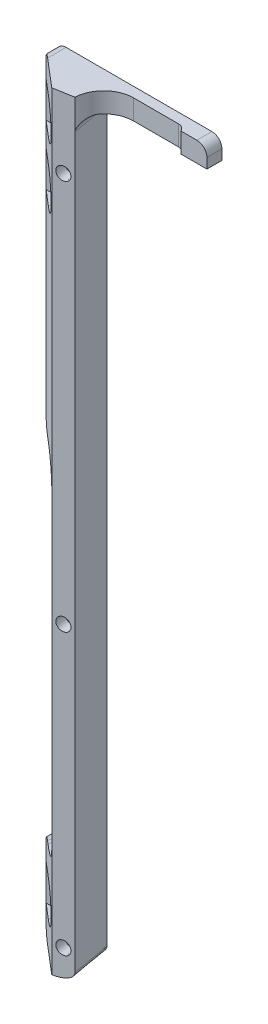
from build123d import *

# Parameters (mm, degrees)
SKETCH2_W                  = 82.738044028
SKETCH2_H                  = 243.598411898
BOSS_EXTRUDE1_DEPTH        = 3.175
BOSS_EXTRUDE2_DEPTH        = 243.598412
CUT_EXTRUDE1_DEPTH         = 6253.234293578
CUT_EXTRUDE1_DEPTH_BACK    = 6253.234293578
SKETCH3_W                  = 10.058364279
SKETCH3_H                  = 111.125
FILLET1_R                  = 6.35
CUT_EXTRUDE2_DEPTH         = 6243.564603497
DELETEFACE2_START          = 830.447299741
DELETEFACE2_OUTLINE_W      = 243.598411898
DELETEFACE2_OUTLINE_H      = 6
DELETEFACE2_DEPTH          = 0.551332964
F_6_0_204_DIAMETER_HOLE1_D = 5.1816
CUT_EXTRUDE3_START         = 3.175
CUT_EXTRUDE3_DEPTH         = 6231.095925463
SKETCH10_W                 = 38.1
SKETCH10_H                 = 3.175
BOSS_EXTRUDE4_DEPTH        = 6.35
BOSS_EXTRUDE6_DEPTH        = 1.5875
CUT_EXTRUDE4_DEPTH         = 913.829845298
FILLET2_R                  = 9.525
FILLET3_R                  = 3.175
SKETCH13_W                 = 8.255
SKETCH13_H                 = 6.35
BOSS_EXTRUDE5_DEPTH        = 1.5875
FILLET4_R                  = 2.54
FILLET5_SIZE               = 6.35
FILLET5_SIZE_2             = 3.175
FILLET6_R                  = 3.175
HOLE1_AT_2_COUNT           = 2
HOLE1_AT_2_PITCH           = 123.825
HOLE1_AT_3_COUNT           = 2
HOLE1_AT_3_PITCH           = 212.6865263
F_4_CLEARANCE_HOLE1_D      = 3.4544


# Read off the part's stored shape, not the designer's step: DeleteFace2
with BuildPart() as part:
    # Sketch2 → Boss-Extrude1 (new body)
    with BuildSketch(Plane.XY):
        with Locations((870.137648104, 6053.851709568)):
            Rectangle(SKETCH2_W, SKETCH2_H)
    extrude(amount=BOSS_EXTRUDE1_DEPTH)

    # Sketch5 → Boss-Extrude2 (add, through all)
    with BuildSketch(Plane(origin=(0, 6175.650915517, 0), x_dir=(1, 0, 0), z_dir=(0, 1, 0))):
        Polygon((828.76862609, -3.175), (840.781978058, -13.382293294), (845.472124982, -12.555293847), (843.81812609, -3.175), align=None)
    extrude(amount=-BOSS_EXTRUDE2_DEPTH)

    # Sketch3 → Cut-Extrude1 (cut, two sides: drawn at the far end of the back side and taken through both)
    with BuildSketch(Plane(origin=(1789.89403363, 0, -153.971769821), x_dir=(-0.9848077530122082, 0, 0.17364817766692958), z_dir=(-0.17364817766692958, 0, -0.9848077530122082)).offset(-CUT_EXTRUDE1_DEPTH_BACK)):
        with Locations((968.782821029, 6016.190003619)):
            Rectangle(SKETCH3_W, SKETCH3_H)
    extrude(amount=CUT_EXTRUDE1_DEPTH + CUT_EXTRUDE1_DEPTH_BACK, mode=Mode.SUBTRACT)

    # Fillet1
    fillet1_edges = [part.edges().sort_by_distance(p)[0] for p in [
        (839.602148372, 6071.752503619, 6.691146647),
        (839.602148372, 5960.627503619, 6.691146647),
    ]]
    fillet(fillet1_edges, radius=FILLET1_R)

    # Sketch4 → Cut-Extrude2 (cut, through all)
    with BuildSketch(Plane.XY.offset(3.175)):
        Polygon((843.81812609, 6170.570915517), (843.81812609, 6175.650915517), (911.506670118, 6175.650915517), (911.506670118, 5932.052503619), (905.156670118, 5932.052503619), (843.81812609, 5932.052503619), align=None)
    extrude(amount=-CUT_EXTRUDE2_DEPTH, mode=Mode.SUBTRACT)

    # DeleteFace2 outline → DeleteFace2 (cut)
    with BuildSketch(Plane(origin=(0, 0, 0), x_dir=(0, 1, 0), z_dir=(0.984807753012209, 0, -0.173648177666925)).offset(DELETEFACE2_START)):
        with Locations((6053.851709568, 148)):
            Rectangle(DELETEFACE2_OUTLINE_W, DELETEFACE2_OUTLINE_H)
    extrude(amount=DELETEFACE2_DEPTH, mode=Mode.SUBTRACT)

    # #6 (0.204) Diameter Hole1 (through all)
    with Locations(Plane(origin=(0, 0, 0), x_dir=(-1, 0, 0), z_dir=(0, 0, -1))):
        with Locations((-833.65812609, 6161.363415517), (-833.65812609, 6142.313415517), (-833.65812609, 5946.340003619)):
            Hole(F_6_0_204_DIAMETER_HOLE1_D / 2)

    # Sketch8 → Cut-Extrude3 (cut, through all)
    with BuildSketch(Plane.XY.offset(CUT_EXTRUDE3_START)):
        with BuildLine():
            Line((833.65812609, 6155.648415517), (828.76862609, 6155.648415517))
            ThreePointArc((828.76862609, 6155.648415517), (823.05362609, 6161.363415517), (828.76862609, 6167.078415517))
            Line((828.76862609, 6167.078415517), (833.65812609, 6167.078415517))
            ThreePointArc((833.65812609, 6167.078415517), (839.37312609, 6161.363415517), (833.65812609, 6155.648415517))
        make_face()
        with BuildLine():
            Line((833.65812609, 6136.598415517), (828.76862609, 6136.598415517))
            ThreePointArc((828.76862609, 6136.598415517), (823.05362609, 6142.313415517), (828.76862609, 6148.028415517))
            Line((828.76862609, 6148.028415517), (833.65812609, 6148.028415517))
            ThreePointArc((833.65812609, 6148.028415517), (839.37312609, 6142.313415517), (833.65812609, 6136.598415517))
        make_face()
        with BuildLine():
            Line((833.65812609, 5940.625003619), (828.76862609, 5940.625003619))
            ThreePointArc((828.76862609, 5940.625003619), (823.05362609, 5946.340003619), (828.76862609, 5952.055003619))
            Line((828.76862609, 5952.055003619), (833.65812609, 5952.055003619))
            ThreePointArc((833.65812609, 5952.055003619), (839.37312609, 5946.340003619), (833.65812609, 5940.625003619))
        make_face()
    extrude(amount=CUT_EXTRUDE3_DEPTH, mode=Mode.SUBTRACT)

    # Sketch10 → Boss-Extrude4 (add)
    with BuildSketch(Plane(origin=(0, 6175.650915517, 0), x_dir=(1, 0, 0), z_dir=(0, 1, 0))):
        with Locations((862.308287926, -1.5875)):
            Rectangle(SKETCH10_W, SKETCH10_H)
    extrude(amount=-BOSS_EXTRUDE4_DEPTH)

    # Sketch14 → Boss-Extrude6 (add)
    with BuildSketch(Plane(origin=(817.830939253, 0, -144.205660248), x_dir=(-0.17364817766692534, 0, -0.9848077530122089), z_dir=(0.9848077530122089, 0, -0.17364817766692534))):
        Polygon((-149.654244494, 6169.300915517), (-149.654244494, 6175.650915517), (-159.179244494, 6175.650915517), (-159.179244494, 5932.052503619), (-146.430265001, 5932.052503619), (-146.430265001, 6169.300915517), align=None)
    extrude(amount=BOSS_EXTRUDE6_DEPTH)

    # Sketch15 → Cut-Extrude4 (cut, through all)
    with BuildSketch(Plane(origin=(0, 6169.300915517, 0), x_dir=(1, 0, 0), z_dir=(0, 1, 0))):
        Polygon((843.258287926, 0), (844.870277672, 0), (844.821670234, 0.275666482), align=None)
    extrude(amount=-CUT_EXTRUDE4_DEPTH, mode=Mode.SUBTRACT)

    # Fillet2
    # the kernel refuses this fillet: 9.525 mm, written as the material it adds along each edge
    with BuildSketch(Plane(origin=(845.430115836, 6175.650915517, 3.175), x_dir=(1, 0, 0), z_dir=(0, -1, 0))) as fillet2_piece_1:
        with BuildLine():
            CenterArc((11.121110651, 9.525), FILLET2_R, 182.529491184, 87.470508816)
            Line((1.605391454, 9.104627365), (1.41507707, 9.096219913))
            ThreePointArc((1.41507707, 9.096219913), (0.61508985, 4.585393661), (-0.187605877, 0.033079978))
            Line((-0.187605877, 0.033079978), (0, -0.1905))
            Line((0, -0.1905), (11.121110651, -0.1905))
            Line((11.121110651, -0.1905), (11.121110651, 0))
        make_face()
    extrude(amount=6.35)

    # Fillet3
    # the kernel refuses this fillet: 3.175 mm, written as the material it adds along each edge
    with BuildSketch(Plane(origin=(847.03550729, 6169.300915517, 12.279627365), x_dir=(0.9848077530122001, 0, -0.17364817766697505), z_dir=(-0.17364817766697507, 0, -0.9848077530122002))) as fillet3_piece_1_section:
        with BuildLine():
            CenterArc((FILLET3_R, FILLET3_R), FILLET3_R, 180, 90)
            Line((0, FILLET3_R), (0, 0))
            Line((0, 0), (FILLET3_R, 0))
        make_face()
    fillet3_piece_1 = extrude(amount=20.406560411, mode=Mode.PRIVATE)
    fillet3_piece_1 = fillet3_piece_1 - Plane(origin=(856.551226487, 6168.523076842, 12.7), x_dir=(1, 0, 0), z_dir=(0, 1, 0)) * Cylinder(9.525, 54, mode=Mode.PRIVATE)
    fillet3_piece_1 = split(fillet3_piece_1, bisect_by=Plane(origin=(846.439228991, 6168.523076842, 0), z_dir=(0, 0, 1)), keep=Keep.TOP, mode=Mode.PRIVATE)
    add(fillet3_piece_1)

    # Sketch13 → Boss-Extrude5 (add)
    with BuildSketch(Plane.XY.offset(3.175)):
        with Locations((877.230787926, 6172.475915517)):
            Rectangle(SKETCH13_W, SKETCH13_H)
    extrude(amount=BOSS_EXTRUDE5_DEPTH)

    # Fillet4
    # the kernel refuses this fillet: 2.54 mm, written as the material it adds along each edge
    with BuildSketch(Plane(origin=(873.103287926, 6175.650915517, 3.175), x_dir=(-1, 0, 0), z_dir=(0, -1, 0))) as fillet4_piece_1:
        with BuildLine():
            CenterArc((2.35464302, -2.54), FILLET4_R, 90, 67.975687163)
            Line((0, -1.5875), (-0.04709286, -1.56845))
            ThreePointArc((-0.04709286, -1.56845), (-0.0508, -0.79375), (-0.0508, 0))
            Line((-0.0508, 0), (0, 0.0508))
            Line((0, 0.0508), (2.35464302, 0.0508))
            Line((2.35464302, 0.0508), (2.35464302, 0))
        make_face()
    extrude(amount=6.35)

    # Fillet5
    # an asymmetric fillet: 6.35, 3.175 mm, written as the material it takes off along each edge
    with BuildSketch(Plane(origin=(849.79217211, 5932.052503619, 27.913450444), x_dir=(-0.9848077530122089, 0, 0.17364817766692534), z_dir=(-0.17364817766692536, 0, -0.984807753012209))) as fillet5_piece_1:
        with BuildLine():
            Bezier((FILLET5_SIZE, 0), (0, 0), (0, FILLET5_SIZE_2), weights=[1, 0.707106781, 1])
            Line((0, FILLET5_SIZE_2), (0, 0))
            Line((0, 0), (FILLET5_SIZE, 0))
        make_face()
    extrude(amount=44.219060411, mode=Mode.SUBTRACT)

    # Fillet6
    # the kernel refuses this fillet: 3.175 mm, written as the material it takes off along each edge
    with BuildSketch(Plane(origin=(828.76862609, 6175.650915517, -7.9375), x_dir=(1, 0, 0), z_dir=(0, 0, 1))) as fillet6_piece_1:
        with BuildLine():
            CenterArc((FILLET6_R, -FILLET6_R), FILLET6_R, 90, 90)
            Line((0, -FILLET6_R), (0, 0))
            Line((0, 0), (FILLET6_R, 0))
        make_face()
    extrude(amount=19.05, mode=Mode.SUBTRACT)
    with BuildSketch(Plane(origin=(828.76862609, 5932.052503619, -7.9375), x_dir=(1, 0, 0), z_dir=(0, 0, 1)), Plane(origin=(828.76862609, 5960.627503619, -7.9375), x_dir=(0, -1, 0), z_dir=(0, 0, 1)), Plane(origin=(828.76862609, 6071.752503619, 11.1125), x_dir=(0, 1, 0), z_dir=(0, 0, -1))) as fillet6_piece_2:
        with BuildLine():
            CenterArc((FILLET6_R, FILLET6_R), FILLET6_R, 180, 90)
            Line((0, FILLET6_R), (0, 0))
            Line((0, 0), (FILLET6_R, 0))
        make_face()
    extrude(amount=19.05, mode=Mode.SUBTRACT)
    with BuildSketch(Plane(origin=(881.358287926, 6175.650915517, -7.9375), x_dir=(-1, 0, 0), z_dir=(0, 0, 1))) as fillet6_piece_3:
        with BuildLine():
            CenterArc((FILLET6_R, FILLET6_R), FILLET6_R, 180, 90)
            Line((0, FILLET6_R), (0, 0))
            Line((0, 0), (FILLET6_R, 0))
        make_face()
    extrude(amount=20.6375, mode=Mode.SUBTRACT)

    # Sketch17 → Hole1 (revolve, cut)
    with BuildSketch(Plane(origin=(843.908742674, 6153.425915517, 12.830960329), x_dir=(0.9848077530122085, 0, -0.17364817766692853), z_dir=(0, 1, 0))):
        Polygon((0, 0), (0, 3.429), (1.9431, 3.429), (2.0701, 0), align=None)
    hole1 = revolve(axis=Axis((824.807443131, 6153.425915517, -95.497892502), (0.1736481776669289, 0, 0.9848077530122084)), mode=Mode.SUBTRACT)

    # Hole1 at 2: Hole1 ×2
    with Locations(*[(0, -i * HOLE1_AT_2_PITCH, 0) for i in range(1, HOLE1_AT_2_COUNT)]):
        add(hole1, mode=Mode.SUBTRACT)

    # Hole1 at 3: Hole1 ×2
    with Locations(*[(0, -i * HOLE1_AT_3_PITCH, 0) for i in range(1, HOLE1_AT_3_COUNT)]):
        add(hole1, mode=Mode.SUBTRACT)

    # #4 Clearance Hole1 (through all)
    with Locations(Plane(origin=(27.641185729, 0, 156.760954096), x_dir=(0.9848077530122085, 0, -0.17364817766692853), z_dir=(0.17364817766692853, 0, 0.9848077530122085))):
        with Locations((828.859799741, 5940.739389217), (828.859799741, 6029.600915517), (828.859799741, 6153.425915517)):
            Hole(F_4_CLEARANCE_HOLE1_D / 2)


solid = part.part
